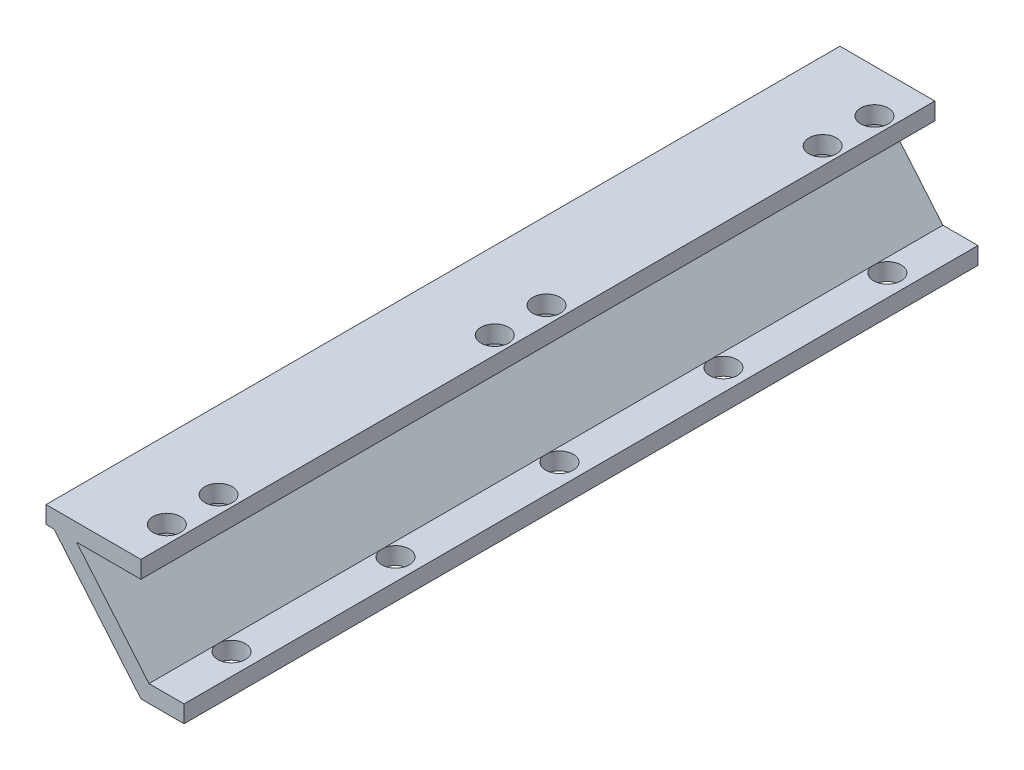
from build123d import *

# Parameters (mm, degrees)
EXTRUDE_1_DEPTH      = 46
EXTRUDE_1_DEPTH_BACK = 46
SKETCH_2_R           = 1.6
CUT_EXTRUDE_1_DEPTH  = 5
SKETCH_3_R           = 1.6
CUT_EXTRUDE_2_DEPTH  = 5


with BuildPart() as part:
    # 스케치1 → 보스-돌출1 (new, two sides: drawn at the far end of the back side and taken through both)
    with BuildSketch(Plane.XY.offset(-EXTRUDE_1_DEPTH_BACK)):
        Polygon((5, 0), (0, 0), (-10.069195574, 12), (-11, 12), (-11, 14), (0, 14), (0, 12), (-7.458380995, 12), (0.932615316, 2), (5, 2), align=None)
    extrude(amount=EXTRUDE_1_DEPTH + EXTRUDE_1_DEPTH_BACK)

    # 스케치2 → 컷-돌출1 (cut)
    with BuildSketch(Plane(origin=(0, 14, 0), x_dir=(1, 0, 0), z_dir=(0, 1, 0))):
        with Locations((-2, 41)):
            Circle(SKETCH_2_R)
        with Locations((-2, 35)):
            Circle(SKETCH_2_R)
        with Locations((-2, 3)):
            Circle(SKETCH_2_R)
        with Locations((-2, -3)):
            Circle(SKETCH_2_R)
        with Locations((-2, -35)):
            Circle(SKETCH_2_R)
        with Locations((-2, -41)):
            Circle(SKETCH_2_R)
    extrude(amount=-CUT_EXTRUDE_1_DEPTH, mode=Mode.SUBTRACT)

    # 스케치3 → 컷-돌출2 (cut)
    with BuildSketch(Plane(origin=(0, 2, 0), x_dir=(1.0, 1.17531647254689e-12, 0), z_dir=(-1.17531647254689e-12, 1.0, 0))):
        with Locations((2.5, 38)):
            Circle(SKETCH_3_R)
        with Locations((2.5, 19)):
            Circle(SKETCH_3_R)
        with Locations((2.5, 0)):
            Circle(SKETCH_3_R)
        with Locations((2.5, -19)):
            Circle(SKETCH_3_R)
        with Locations((2.5, -38)):
            Circle(SKETCH_3_R)
    extrude(amount=-CUT_EXTRUDE_2_DEPTH, mode=Mode.SUBTRACT)


solid = part.part
